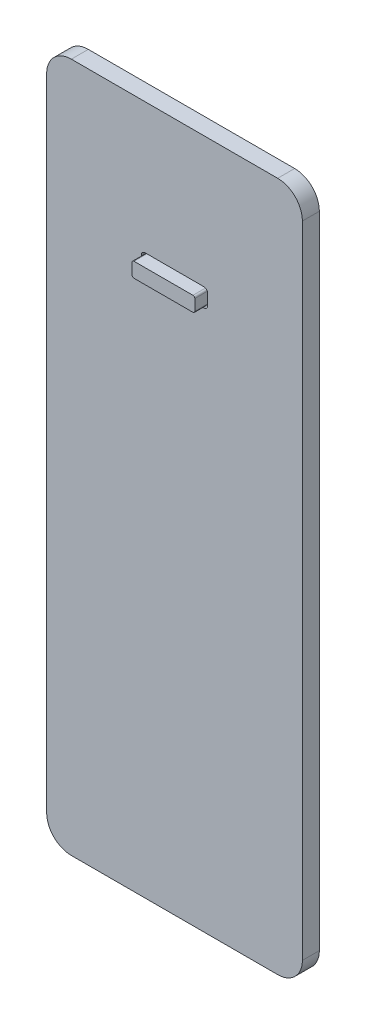
from build123d import *

# Parameters (mm, degrees)
STOCK_PB_TOP_LID_SM_1_START = 11.200003695
STOCK_PB_TOP_LID_SM_1_DEPTH = 2.3
BOSS_EXTRUDE1_DEPTH         = 3.8
BOSS_EXTRUDE2_DEPTH         = 2
SKETCH5_R                   = 2.5
BOSS_EXTRUDE3_DEPTH         = 5.2
SKETCH6_R                   = 1
CUT_EXTRUDE1_DEPTH          = 0.1
FILLET1_R                   = 0.5


# Read off the part's stored shape, not the designer's step: Stock-pb_top_lid_sm-1
with BuildPart() as part:
    # Stock-pb_top_lid_sm-1 outline → Stock-pb_top_lid_sm-1 (new body)
    with BuildSketch(Plane(origin=(0, 0, 0), x_dir=(1, 0, 0), z_dir=(0, 1.3113422028449806e-07, -0.9999999999999915)).offset(STOCK_PB_TOP_LID_SM_1_START)):
        with BuildLine():
            Line((-3.5, -24.849998248), (24.5, -24.849998482))
            ThreePointArc((24.5, -24.849998482), (26.868807895, -23.868806125), (27.850000252, -21.49999823))
            Line((27.850000252, -21.49999823), (27.85, 65.381136149))
            ThreePointArc((27.85, 65.381136149), (26.868807717, 67.749943866), (24.5, 68.731136149))
            Line((24.5, 68.731136149), (-3.5, 68.731136149))
            ThreePointArc((-3.5, 68.731136149), (-5.868807606, 67.749943977), (-6.85, 65.381136463))
            Line((-6.85, 65.381136463), (-6.850000018, -21.49999823))
            ThreePointArc((-6.850000018, -21.49999823), (-5.86880773, -23.86880596), (-3.5, -24.849998248))
        make_face()
        with BuildLine():
            ThreePointArc((14.500000108, -4.599998248), (14.853553499, -4.746444857), (15.000000108, -5.099998248))
            Line((15.000000108, -5.099998248), (15.000000108, -6.599997786))
            ThreePointArc((15.000000108, -6.599997786), (14.853553662, -6.953551475), (14.500000108, -7.099998248))
            Line((14.500000108, -7.099998248), (6.500000108, -7.099998248))
            ThreePointArc((6.500000108, -7.099998248), (6.146446718, -6.953551638), (6.000000108, -6.599998248))
            Line((6.000000108, -6.599998248), (6.000000108, -5.099998248))
            ThreePointArc((6.000000108, -5.099998248), (6.146446717, -4.746444858), (6.500000108, -4.599998248))
            Line((6.500000108, -4.599998248), (14.500000108, -4.599998248))
        make_face(mode=Mode.SUBTRACT)
    extrude(amount=STOCK_PB_TOP_LID_SM_1_DEPTH)


with BuildPart() as body_2:
    # Sketch3 → Boss-Extrude1 (new body)
    with BuildSketch(Plane(origin=(0, 1.77e-06, -13.500003695), x_dir=(-1, 0, 0), z_dir=(0, 1.3113422028449777e-07, -0.9999999999999915))):
        with BuildLine():
            Line((-14.500000108, 4.849998248), (-6.500000108, 4.849998248))
            ThreePointArc((-6.500000108, 4.849998248), (-6.323223413, 4.923221552), (-6.250000108, 5.099998248))
            Line((-6.250000108, 5.099998248), (-6.250000108, 6.599998248))
            ThreePointArc((-6.250000108, 6.599998248), (-6.323223413, 6.776774943), (-6.500000108, 6.849998248))
            Line((-6.500000108, 6.849998248), (-14.500000108, 6.849998248))
            ThreePointArc((-14.500000108, 6.849998248), (-14.676776803, 6.776774943), (-14.750000108, 6.599998248))
            Line((-14.750000108, 6.599998248), (-14.750000108, 5.099998248))
            ThreePointArc((-14.750000108, 5.099998248), (-14.676776803, 4.923221552), (-14.500000108, 4.849998248))
        make_face()
    extrude(amount=-BOSS_EXTRUDE1_DEPTH)

    # Sketch4 → Boss-Extrude2 (add)
    with BuildSketch(Plane(origin=(0, 1.77e-06, -13.500003695), x_dir=(-1, 0, 0), z_dir=(0, 1.311342202844978e-07, -0.9999999999999915))):
        with BuildLine():
            Line((-4.250000108, 5.099998248), (-4.250000108, 6.599998248))
            ThreePointArc((-4.250000108, 6.599998248), (-4.909009851, 8.190988505), (-6.500000108, 8.849998248))
            Line((-6.500000108, 8.849998248), (-14.500000108, 8.849998248))
            ThreePointArc((-14.500000108, 8.849998248), (-16.090990366, 8.190988505), (-16.750000108, 6.599998248))
            Line((-16.750000108, 6.599998248), (-16.750000108, 5.099998248))
            ThreePointArc((-16.750000108, 5.099998248), (-16.090990366, 3.50900799), (-14.500000108, 2.849998248))
            Line((-14.500000108, 2.849998248), (-6.500000108, 2.849998248))
            ThreePointArc((-6.500000108, 2.849998248), (-4.909009851, 3.50900799), (-4.250000108, 5.099998248))
        make_face()
    extrude(amount=BOSS_EXTRUDE2_DEPTH)

    # Sketch5 → Boss-Extrude3 (add)
    with BuildSketch(Plane(origin=(0, 2.033e-06, -15.500003695), x_dir=(-1, 0, 0), z_dir=(0, 1.3113422028449782e-07, -0.9999999999999915))):
        with Locations(Location((-10.500000108, 5.849998248, 0), (0, 0, 90))):
            Circle(SKETCH5_R)
    extrude(amount=BOSS_EXTRUDE3_DEPTH)

    # Sketch6 → Cut-Extrude1 (cut)
    with BuildSketch(Plane(origin=(0, 2.714e-06, -20.700003695), x_dir=(-1, 0, 0), z_dir=(0, 1.3113422028449785e-07, -0.9999999999999915))):
        with Locations(Location((-10.500000108, 5.849998248, 0), (0, 0, 90))):
            Circle(SKETCH6_R)
    extrude(amount=-CUT_EXTRUDE1_DEPTH, mode=Mode.SUBTRACT)

    # Fillet1
    # the kernel refuses this fillet: 0.5 mm, written as the material it takes off along each edge
    with BuildSketch(Plane(origin=(10.500000108, 5.850000962, -20.700002928), x_dir=(0, 0.9999999999999915, 1.3113421815091902e-07), z_dir=(-1, 0, 0))) as fillet1_piece_1:
        with BuildLine():
            CenterArc((1.3, -0.5), FILLET1_R, 90, 36.869897646)
            Line((1, -0.1), (0.994, -0.092))
            ThreePointArc((0.994, -0.092), (0.99, -0.05), (0.99, 0))
            Line((0.99, 0), (1, 0.01))
            Line((1, 0.01), (1.3, 0.01))
            Line((1.3, 0.01), (1.3, 0))
        make_face()
    revolve(axis=Axis((10.500000108, 5.850000962, -20.700002928), (0, 1.3113422028449785e-07, -0.9999999999999915)), mode=Mode.SUBTRACT)


solid = Compound([part.part, body_2.part])
